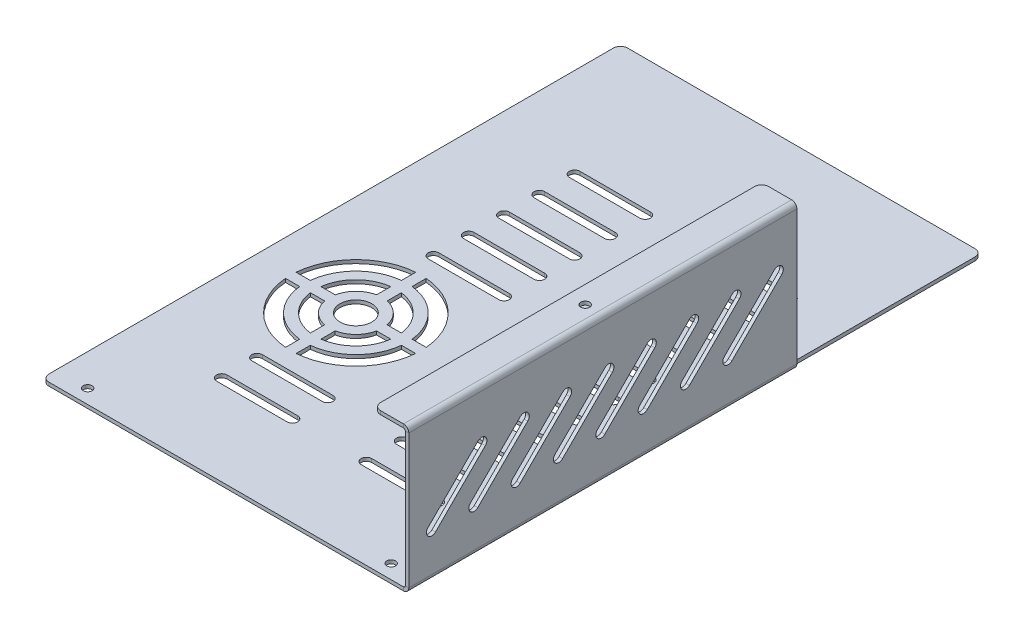
from build123d import *

# Parameters (mm, degrees)
BASE_FLANGE1_DEPTH  = 164
CUT_EXTRUDE1_DEPTH  = 54
CUT_EXTRUDE2_DEPTH  = 50
SKETCH4_R           = 1.25
CUT_EXTRUDE3_DEPTH  = 1
SKETCH5_R           = 1.25
CUT_EXTRUDE4_DEPTH  = 1
FILLET1_R           = 2
CUT_EXTRUDE5_DEPTH  = 1
SKETCH8_W           = 23
SKETCH8_H           = 33
BOSS_EXTRUDE1_DEPTH = 1
SKETCH9_R           = 4.5
CUT_EXTRUDE6_DEPTH  = 1


# Sheet-metal steps are written as plain solids
with BuildPart() as part:
    # Sketch1 → Base-Flange1 (new body)
    with BuildSketch(Plane.XY):
        with BuildLine():
            Line((-10, 41), (-1.5, 41))
            ThreePointArc((-1.5, 41), (-0.439339828, 40.560660172), (0, 39.5))
            Line((0, 39.5), (0, 1.5))
            ThreePointArc((0, 1.5), (-0.439339828, 0.439339828), (-1.5, 0))
            Line((-1.5, 0), (-104, 0))
            Line((-104, 0), (-104, 1))
            Line((-104, 1), (-1.5, 1))
            ThreePointArc((-1.5, 1), (-1.146446609, 1.146446609), (-1, 1.5))
            Line((-1, 1.5), (-1, 39.5))
            ThreePointArc((-1, 39.5), (-1.146446609, 39.853553391), (-1.5, 40))
            Line((-1.5, 40), (-10, 40))
            Line((-10, 40), (-10, 41))
        make_face()
    extrude(amount=BASE_FLANGE1_DEPTH)

    # Sketch2 → Cut-Extrude1 (cut)
    with BuildSketch(Plane(origin=(0, 0, 0), x_dir=(-1, 0, 0), z_dir=(0, 0, -1))):
        Polygon((1.5, 0), (1.5, 1), (10, 40), (10, 41), (0, 41), (0, 0), align=None)
    extrude(amount=-CUT_EXTRUDE1_DEPTH, mode=Mode.SUBTRACT)

    # Sketch3 → Cut-Extrude2 (cut)
    with BuildSketch(Plane(origin=(0, 0, 0), x_dir=(0, 0, -1), z_dir=(1, 0, 0))):
        with BuildLine():
            Line((-142.297204204, 25.581475452), (-156.439339828, 11.439339828))
            ThreePointArc((-156.439339828, 11.439339828), (-158.560660172, 11.439339828), (-158.560660172, 13.560660172))
            Line((-158.560660172, 13.560660172), (-144.418524548, 27.702795796))
            ThreePointArc((-144.418524548, 27.702795796), (-142.297204204, 27.702795796), (-142.297204204, 25.581475452))
        make_face()
        with BuildLine():
            Line((-130.297204204, 25.581475452), (-144.439339828, 11.439339828))
            ThreePointArc((-144.439339828, 11.439339828), (-146.560660172, 11.439339828), (-146.560660172, 13.560660172))
            Line((-146.560660172, 13.560660172), (-132.418524548, 27.702795796))
            ThreePointArc((-132.418524548, 27.702795796), (-130.297204204, 27.702795796), (-130.297204204, 25.581475452))
        make_face()
        with BuildLine():
            Line((-118.297204204, 25.581475452), (-132.439339828, 11.439339828))
            ThreePointArc((-132.439339828, 11.439339828), (-134.560660172, 11.439339828), (-134.560660172, 13.560660172))
            Line((-134.560660172, 13.560660172), (-120.418524548, 27.702795796))
            ThreePointArc((-120.418524548, 27.702795796), (-118.297204204, 27.702795796), (-118.297204204, 25.581475452))
        make_face()
        with BuildLine():
            Line((-106.297204204, 25.581475452), (-120.439339828, 11.439339828))
            ThreePointArc((-120.439339828, 11.439339828), (-122.560660172, 11.439339828), (-122.560660172, 13.560660172))
            Line((-122.560660172, 13.560660172), (-108.418524548, 27.702795796))
            ThreePointArc((-108.418524548, 27.702795796), (-106.297204204, 27.702795796), (-106.297204204, 25.581475452))
        make_face()
        with BuildLine():
            Line((-94.297204204, 25.581475452), (-108.439339828, 11.439339828))
            ThreePointArc((-108.439339828, 11.439339828), (-110.560660172, 11.439339828), (-110.560660172, 13.560660172))
            Line((-110.560660172, 13.560660172), (-96.418524548, 27.702795796))
            ThreePointArc((-96.418524548, 27.702795796), (-94.297204204, 27.702795796), (-94.297204204, 25.581475452))
        make_face()
        with BuildLine():
            Line((-82.297204204, 25.581475452), (-96.439339828, 11.439339828))
            ThreePointArc((-96.439339828, 11.439339828), (-98.560660172, 11.439339828), (-98.560660172, 13.560660172))
            Line((-98.560660172, 13.560660172), (-84.418524548, 27.702795796))
            ThreePointArc((-84.418524548, 27.702795796), (-82.297204204, 27.702795796), (-82.297204204, 25.581475452))
        make_face()
        with BuildLine():
            Line((-70.297204204, 25.581475452), (-84.439339828, 11.439339828))
            ThreePointArc((-84.439339828, 11.439339828), (-86.560660172, 11.439339828), (-86.560660172, 13.560660172))
            Line((-86.560660172, 13.560660172), (-72.418524548, 27.702795796))
            ThreePointArc((-72.418524548, 27.702795796), (-70.297204204, 27.702795796), (-70.297204204, 25.581475452))
        make_face()
        with BuildLine():
            Line((-58.297204204, 25.581475452), (-72.439339828, 11.439339828))
            ThreePointArc((-72.439339828, 11.439339828), (-74.560660172, 11.439339828), (-74.560660172, 13.560660172))
            Line((-74.560660172, 13.560660172), (-60.418524548, 27.702795796))
            ThreePointArc((-60.418524548, 27.702795796), (-58.297204204, 27.702795796), (-58.297204204, 25.581475452))
        make_face()
    extrude(amount=-CUT_EXTRUDE2_DEPTH, mode=Mode.SUBTRACT)

    # Sketch4 → Cut-Extrude3 (cut)
    with BuildSketch(Plane(origin=(0, 41, 0), x_dir=(1, 0, 0), z_dir=(0, 1, 0))):
        with Locations(Location((-5, -109, 0), (0, 0, 270))):
            Circle(SKETCH4_R)
    extrude(amount=-CUT_EXTRUDE3_DEPTH, mode=Mode.SUBTRACT)

    # Sketch5 → Cut-Extrude4 (cut)
    with BuildSketch(Plane.XZ):
        with Locations((-95, 160)):
            Circle(SKETCH5_R)
        with Locations((-9, 160)):
            Circle(SKETCH5_R)
        with Locations((-39, 30)):
            Circle(SKETCH5_R)
    extrude(amount=-CUT_EXTRUDE4_DEPTH, mode=Mode.SUBTRACT)

    # Fillet1
    fillet1_edges = [part.edges().sort_by_distance(p)[0] for p in [
        (-104, 0.5, 0),
        (-1.5, 0.5, 0),
        (-10, 40.5, 164),
        (-10, 40.5, 54),
        (-104, 0.5, 164),
    ]]
    fillet(fillet1_edges, radius=FILLET1_R)

    # Sketch7 → Cut-Extrude5 (cut)
    with BuildSketch(Plane.XZ):
        with BuildLine():
            Line((-78.5, 140), (-58.5, 140))
            ThreePointArc((-58.5, 140), (-57, 138.5), (-58.5, 137))
            Line((-58.5, 137), (-78.5, 137))
            ThreePointArc((-78.5, 137), (-80, 138.5), (-78.5, 140))
        make_face()
        with BuildLine():
            Line((-37.5, 140), (-17.5, 140))
            ThreePointArc((-17.5, 140), (-16, 138.5), (-17.5, 137))
            Line((-17.5, 137), (-37.5, 137))
            ThreePointArc((-37.5, 137), (-39, 138.5), (-37.5, 140))
        make_face()
        with BuildLine():
            Line((-78.5, 130), (-58.5, 130))
            ThreePointArc((-58.5, 130), (-57, 128.5), (-58.5, 127))
            Line((-58.5, 127), (-78.5, 127))
            ThreePointArc((-78.5, 127), (-80, 128.5), (-78.5, 130))
        make_face()
        with BuildLine():
            Line((-37.5, 130), (-17.5, 130))
            ThreePointArc((-17.5, 130), (-16, 128.5), (-17.5, 127))
            Line((-17.5, 127), (-37.5, 127))
            ThreePointArc((-37.5, 127), (-39, 128.5), (-37.5, 130))
        make_face()
        with BuildLine():
            Line((-78.5, 120), (-58.5, 120))
            ThreePointArc((-58.5, 120), (-57, 118.5), (-58.5, 117))
            Line((-58.5, 117), (-78.5, 117))
            ThreePointArc((-78.5, 117), (-80, 118.5), (-78.5, 120))
        make_face()
        with BuildLine():
            Line((-37.5, 120), (-17.5, 120))
            ThreePointArc((-17.5, 120), (-16, 118.5), (-17.5, 117))
            Line((-17.5, 117), (-37.5, 117))
            ThreePointArc((-37.5, 117), (-39, 118.5), (-37.5, 120))
        make_face()
        with BuildLine():
            Line((-78.5, 110), (-58.5, 110))
            ThreePointArc((-58.5, 110), (-57, 108.5), (-58.5, 107))
            Line((-58.5, 107), (-78.5, 107))
            ThreePointArc((-78.5, 107), (-80, 108.5), (-78.5, 110))
        make_face()
        with BuildLine():
            Line((-37.5, 110), (-17.5, 110))
            ThreePointArc((-17.5, 110), (-16, 108.5), (-17.5, 107))
            Line((-17.5, 107), (-37.5, 107))
            ThreePointArc((-37.5, 107), (-39, 108.5), (-37.5, 110))
        make_face()
        with BuildLine():
            Line((-78.5, 100), (-58.5, 100))
            ThreePointArc((-58.5, 100), (-57, 98.5), (-58.5, 97))
            Line((-58.5, 97), (-78.5, 97))
            ThreePointArc((-78.5, 97), (-80, 98.5), (-78.5, 100))
        make_face()
        with BuildLine():
            Line((-37.5, 100), (-17.5, 100))
            ThreePointArc((-17.5, 100), (-16, 98.5), (-17.5, 97))
            Line((-17.5, 97), (-37.5, 97))
            ThreePointArc((-37.5, 97), (-39, 98.5), (-37.5, 100))
        make_face()
        with BuildLine():
            Line((-78.5, 90), (-58.5, 90))
            ThreePointArc((-58.5, 90), (-57, 88.5), (-58.5, 87))
            Line((-58.5, 87), (-78.5, 87))
            ThreePointArc((-78.5, 87), (-80, 88.5), (-78.5, 90))
        make_face()
        with BuildLine():
            Line((-37.5, 90), (-17.5, 90))
            ThreePointArc((-17.5, 90), (-16, 88.5), (-17.5, 87))
            Line((-17.5, 87), (-37.5, 87))
            ThreePointArc((-37.5, 87), (-39, 88.5), (-37.5, 90))
        make_face()
        with BuildLine():
            Line((-78.5, 80), (-58.5, 80))
            ThreePointArc((-58.5, 80), (-57, 78.5), (-58.5, 77))
            Line((-58.5, 77), (-78.5, 77))
            ThreePointArc((-78.5, 77), (-80, 78.5), (-78.5, 80))
        make_face()
        with BuildLine():
            Line((-37.5, 80), (-17.5, 80))
            ThreePointArc((-17.5, 80), (-16, 78.5), (-17.5, 77))
            Line((-17.5, 77), (-37.5, 77))
            ThreePointArc((-37.5, 77), (-39, 78.5), (-37.5, 80))
        make_face()
        with BuildLine():
            Line((-78.5, 70), (-58.5, 70))
            ThreePointArc((-58.5, 70), (-57, 68.5), (-58.5, 67))
            Line((-58.5, 67), (-78.5, 67))
            ThreePointArc((-78.5, 67), (-80, 68.5), (-78.5, 70))
        make_face()
        with BuildLine():
            Line((-37.5, 70), (-17.5, 70))
            ThreePointArc((-17.5, 70), (-16, 68.5), (-17.5, 67))
            Line((-17.5, 67), (-37.5, 67))
            ThreePointArc((-37.5, 67), (-39, 68.5), (-37.5, 70))
        make_face()
        with BuildLine():
            Line((-78.5, 60), (-58.5, 60))
            ThreePointArc((-58.5, 60), (-57, 58.5), (-58.5, 57))
            Line((-58.5, 57), (-78.5, 57))
            ThreePointArc((-78.5, 57), (-80, 58.5), (-78.5, 60))
        make_face()
        with BuildLine():
            Line((-37.5, 60), (-17.5, 60))
            ThreePointArc((-17.5, 60), (-16, 58.5), (-17.5, 57))
            Line((-17.5, 57), (-37.5, 57))
            ThreePointArc((-37.5, 57), (-39, 58.5), (-37.5, 60))
        make_face()
        with BuildLine():
            Line((-78.5, 50), (-58.5, 50))
            ThreePointArc((-58.5, 50), (-57, 48.5), (-58.5, 47))
            Line((-58.5, 47), (-78.5, 47))
            ThreePointArc((-78.5, 47), (-80, 48.5), (-78.5, 50))
        make_face()
        with BuildLine():
            Line((-37.5, 50), (-17.5, 50))
            ThreePointArc((-17.5, 50), (-16, 48.5), (-17.5, 47))
            Line((-17.5, 47), (-37.5, 47))
            ThreePointArc((-37.5, 47), (-39, 48.5), (-37.5, 50))
        make_face()
        with BuildLine():
            Line((-78.5, 40), (-58.5, 40))
            ThreePointArc((-58.5, 40), (-57, 38.5), (-58.5, 37))
            Line((-58.5, 37), (-78.5, 37))
            ThreePointArc((-78.5, 37), (-80, 38.5), (-78.5, 40))
        make_face()
        with BuildLine():
            Line((-37.5, 40), (-17.5, 40))
            ThreePointArc((-17.5, 40), (-16, 38.5), (-17.5, 37))
            Line((-17.5, 37), (-37.5, 37))
            ThreePointArc((-37.5, 37), (-39, 38.5), (-37.5, 40))
        make_face()
    extrude(amount=-CUT_EXTRUDE5_DEPTH, mode=Mode.SUBTRACT)

    # Sketch8 → Boss-Extrude1 (add)
    with BuildSketch(Plane.XZ):
        with Locations((-68.5, 103.5)):
            Rectangle(SKETCH8_W, SKETCH8_H)
    extrude(amount=-BOSS_EXTRUDE1_DEPTH)

    # Sketch9 → Cut-Extrude6 (cut)
    with BuildSketch(Plane.XZ):
        with Locations((-75.5, 103.5)):
            Circle(SKETCH9_R)
        with BuildLine():
            Line((-74, 121.939088915), (-74, 117.922205102))
            ThreePointArc((-74, 117.922205102), (-65.246951673, 113.753048327), (-61.077794898, 105))
            Line((-61.077794898, 105), (-57.060911085, 105))
            ThreePointArc((-57.060911085, 105), (-62.418524548, 116.581475452), (-74, 121.939088915))
        make_face()
        with BuildLine():
            Line((-77, 121.939088915), (-77, 117.922205102))
            ThreePointArc((-77, 117.922205102), (-85.753048327, 113.753048327), (-89.922205102, 105))
            Line((-89.922205102, 105), (-93.939088915, 105))
            ThreePointArc((-93.939088915, 105), (-88.581475452, 116.581475452), (-77, 121.939088915))
        make_face()
        with BuildLine():
            Line((-57.060911085, 102), (-61.077794898, 102))
            ThreePointArc((-61.077794898, 102), (-65.246951673, 93.246951673), (-74, 89.077794898))
            Line((-74, 89.077794898), (-74, 85.060911085))
            ThreePointArc((-74, 85.060911085), (-62.418524548, 90.418524548), (-57.060911085, 102))
        make_face()
        with BuildLine():
            Line((-77, 85.060911085), (-77, 89.077794898))
            ThreePointArc((-77, 89.077794898), (-85.753048327, 93.246951673), (-89.922205102, 102))
            Line((-89.922205102, 102), (-93.939088915, 102))
            ThreePointArc((-93.939088915, 102), (-88.581475452, 90.418524548), (-77, 85.060911085))
        make_face()
        with BuildLine():
            Line((-77, 114.901754251), (-77, 110.848469228))
            ThreePointArc((-77, 110.848469228), (-80.803300859, 108.803300859), (-82.848469228, 105))
            Line((-82.848469228, 105), (-86.901754251, 105))
            ThreePointArc((-86.901754251, 105), (-83.631727984, 111.631727984), (-77, 114.901754251))
        make_face()
        with BuildLine():
            Line((-74, 114.901754251), (-74, 110.848469228))
            ThreePointArc((-74, 110.848469228), (-70.196699141, 108.803300859), (-68.151530772, 105))
            Line((-68.151530772, 105), (-64.098245749, 105))
            ThreePointArc((-64.098245749, 105), (-67.368272016, 111.631727984), (-74, 114.901754251))
        make_face()
        with BuildLine():
            Line((-86.901754251, 102), (-82.848469228, 102))
            ThreePointArc((-82.848469228, 102), (-80.803300859, 98.196699141), (-77, 96.151530772))
            Line((-77, 96.151530772), (-77, 92.098245749))
            ThreePointArc((-77, 92.098245749), (-83.631727984, 95.368272016), (-86.901754251, 102))
        make_face()
        with BuildLine():
            Line((-74, 92.098245749), (-74, 96.151530772))
            ThreePointArc((-74, 96.151530772), (-70.196699141, 98.196699141), (-68.151530772, 102))
            Line((-68.151530772, 102), (-64.098245749, 102))
            ThreePointArc((-64.098245749, 102), (-67.368272016, 95.368272016), (-74, 92.098245749))
        make_face()
    extrude(amount=-CUT_EXTRUDE6_DEPTH, mode=Mode.SUBTRACT)


solid = part.part
